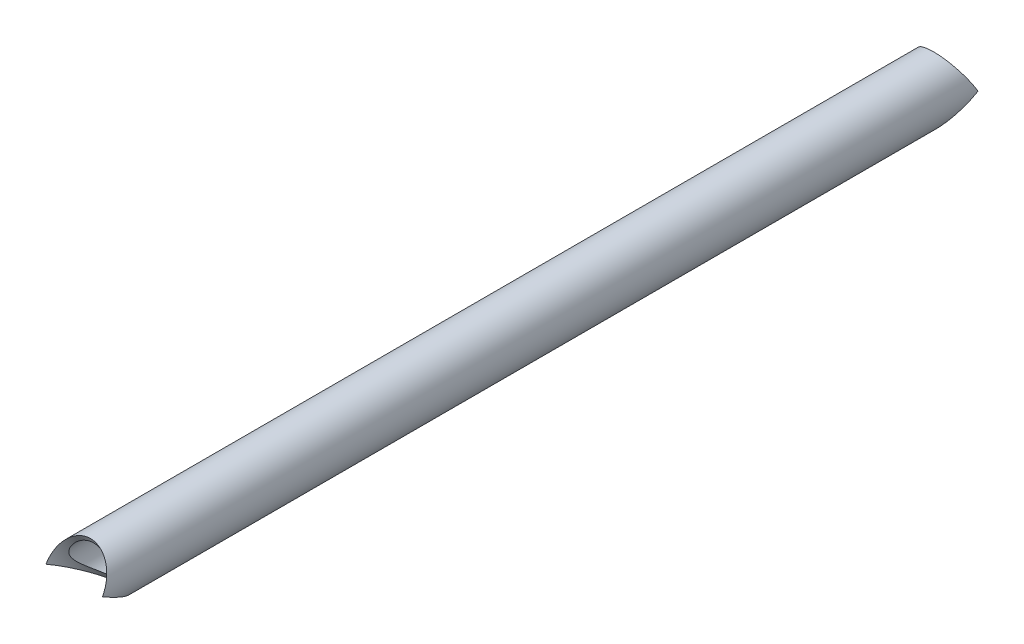
from build123d import *

# Parameters (mm, degrees)
EXTRUDE_START           = -146.897476
EXTRUDE_1_OUTLINE_R     = 10.65
EXTRUDE_1_OUTLINE_R_2   = 8.65
EXTRUDE_1_DEPTH         = 146.897476
EXTRUDE_START_2         = -165.343817
EXTRUDE_1_2_OUTLINE_R   = 10.65
EXTRUDE_1_2_OUTLINE_R_2 = 8.65
EXTRUDE_1_2_DEPTH       = 18.446341
EXTRUDE_START_3         = -98.707445
EXTRUDE_1_3_DEPTH       = 101.707445


with BuildPart() as part:
    # Бобышка-Вытянуть1: read off the stored shape, not the designer's step
    # Бобышка-Вытянуть1 outline → Бобышка-Вытянуть1 (new body)
    with BuildSketch(Plane.XY.offset(EXTRUDE_START)):
        with Locations((0, -103.32754)):
            Circle(EXTRUDE_1_OUTLINE_R)
        with Locations((0, -103.32754)):
            Circle(EXTRUDE_1_OUTLINE_R_2, mode=Mode.SUBTRACT)
    extrude(amount=EXTRUDE_1_DEPTH)

    # Extrude 1 2 outline → Extrude 1 2 (add)
    with BuildSketch(Plane.XY.offset(EXTRUDE_START_2)):
        with Locations((0, -103.32754)):
            Circle(EXTRUDE_1_2_OUTLINE_R)
        with Locations((0, -103.32754)):
            Circle(EXTRUDE_1_2_OUTLINE_R_2, mode=Mode.SUBTRACT)
    extrude(amount=EXTRUDE_1_2_DEPTH)

    # Extrude 1 3 outline → Extrude 1 3 (cut)
    with BuildSketch(Plane(origin=(0, 0, 0), x_dir=(1, 0, 0), z_dir=(0, 0.8660254037845095, -0.4999999999998773)).offset(EXTRUDE_START_3)):
        with BuildLine():
            ThreePointArc((-10.65, 194.855716), (0, 184.205716), (10.65, 194.855716))
            Line((10.65, 194.855716), (10.65, 202))
            Line((10.65, 202), (-10.65, 202))
            Line((-10.65, 202), (-10.65, 194.855716))
        make_face()
    extrude(amount=EXTRUDE_1_3_DEPTH, mode=Mode.SUBTRACT)

    # Зеркальное отражение1: part across plane


with BuildPart() as part_1:
    add(part.part)
    add(part.part.mirror(Plane(origin=(0, -103.32754, 0), x_dir=(1, 0, 0), z_dir=(0, 0, 1))))


solid = part_1.part
